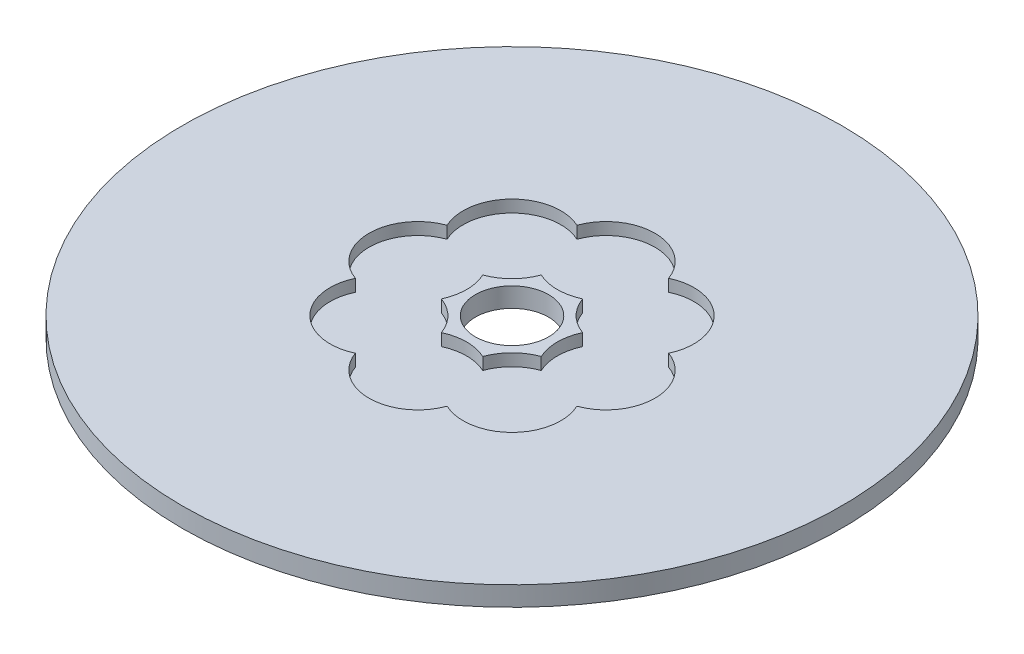
from build123d import *

# Parameters (mm, degrees)
SKETCH1_R           = 67.5
BOSS_EXTRUDE1_DEPTH = 4
SKETCH2_R           = 7.5
CUT_EXTRUDE1_DEPTH  = 96.543183954
SKETCH3_R           = 10
CUT_EXTRUDE2_DEPTH  = 2.485753536
CIRPATTERN1_COUNT   = 8


with BuildPart() as part:
    # Sketch1 → Boss-Extrude1 (new body)
    with BuildSketch(Plane(origin=(0, 0, 0), x_dir=(1, 0, 0), z_dir=(0, 1, 0))):
        Circle(SKETCH1_R)
    extrude(amount=BOSS_EXTRUDE1_DEPTH)

    # Sketch2 → Cut-Extrude1 (cut, through all)
    with BuildSketch(Plane(origin=(0, 0, 0), x_dir=(1, 0, 0), z_dir=(0, 1, 0))):
        Circle(SKETCH2_R)
    extrude(amount=CUT_EXTRUDE1_DEPTH, mode=Mode.SUBTRACT)

    # Sketch3 → Cut-Extrude2 (cut)
    with BuildSketch(Plane(origin=(0, 4, 0), x_dir=(1, 0, 0), z_dir=(0, 1, 0))):
        with Locations((-19.280397609, 0)):
            Circle(SKETCH3_R)
    cut_extrude2 = extrude(amount=-CUT_EXTRUDE2_DEPTH, mode=Mode.SUBTRACT)

    # CirPattern1: Cut-Extrude2 ×8 about axis
    cirpattern1_axis = Axis((0, 0, 0), (0, 1, 0))
    for i in range(1, CIRPATTERN1_COUNT):
        add(cut_extrude2.rotate(cirpattern1_axis, i * 360 / CIRPATTERN1_COUNT), mode=Mode.SUBTRACT)


solid = part.part
